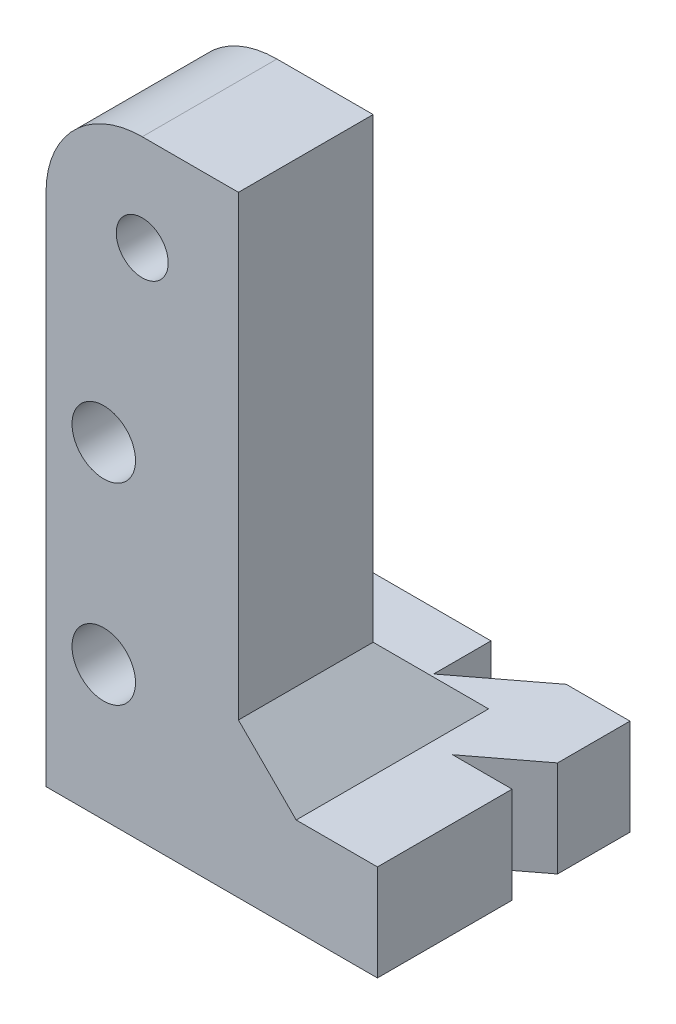
from build123d import *

# Parameters (mm, degrees)
SKETCH_1_W           = 62
SKETCH_1_H           = 46
EXTRUDE_1_DEPTH      = 5
SKETCH_2_W           = 10
SKETCH_2_H           = 17
EXTRUDE_2_DEPTH      = 7
SKETCH_3_R           = 1.65
CUT_EXTRUDE_1_DEPTH  = 12
SKETCH_7_W           = 10
SKETCH_7_H           = 7
EXTRUDE_4_DEPTH      = 9.75
CUT_EXTRUDE_4_REACH  = 65.914
SKETCH_8_R           = 1.35
CUT_EXTRUDE_2_DEPTH  = 2.7
CUT_EXTRUDE_3_REACH  = 51.981
SKETCH_5_W           = 42
SKETCH_5_H           = 32
EXTRUDE_3_DEPTH      = 5
CHAMFER_4_SIZE       = 3
FILLET_1_R           = 5
SKETCH_9_OUTSIDE_W   = 80.694
SKETCH_9_OUTSIDE_H   = 64.694
SKETCH_9_OUTSIDE_W_2 = 19.744354218
SKETCH_9_OUTSIDE_H_2 = 18.428063936
CUT_EXTRUDE_5_DEPTH  = 31.75


with BuildPart() as part:
    # 草图1 → 凸台-拉伸1 (new body)
    with BuildSketch(Plane(origin=(0, 0, 0), x_dir=(1, 0, 0), z_dir=(0, 1, 0))):
        Rectangle(SKETCH_1_W, SKETCH_1_H)
    extrude(amount=EXTRUDE_1_DEPTH)

    # 草图2 → 凸台-拉伸2 (add)
    with BuildSketch(Plane.XY.offset(23)):
        with Locations((-26, 13.5)):
            Rectangle(SKETCH_2_W, SKETCH_2_H)
        with Locations((26, 13.5)):
            Rectangle(SKETCH_2_W, SKETCH_2_H)
    extrude_2 = extrude(amount=-EXTRUDE_2_DEPTH)

    # 草图3 → 切除-拉伸1 (cut)
    with BuildSketch(Plane.XY.offset(23)):
        with Locations((-28, 17)):
            Circle(SKETCH_3_R)
        with Locations((-28, 7)):
            Circle(SKETCH_3_R)
        with Locations((28, 7)):
            Circle(SKETCH_3_R)
        with Locations((28, 17)):
            Circle(SKETCH_3_R)
    cut_extrude_1 = extrude(amount=-CUT_EXTRUDE_1_DEPTH, mode=Mode.SUBTRACT)

    # 草图7 → 凸台-拉伸4 (add)
    with BuildSketch(Plane(origin=(0, 22, 0), x_dir=(1, 0, 0), z_dir=(0, 1, 0))):
        with Locations((-26, -19.5)):
            Rectangle(SKETCH_7_W, SKETCH_7_H)
        with Locations((26, -19.5)):
            Rectangle(SKETCH_7_W, SKETCH_7_H)
    extrude_4 = extrude(amount=EXTRUDE_4_DEPTH)

    # 草图8 → 切除-拉伸4 (cut, up to next)
    with BuildSketch(Plane.XY.offset(23), mode=Mode.PRIVATE) as cut_extrude_4_sk1:
        with Locations((-26, 26.75)):
            Circle(SKETCH_8_R)
    cut_extrude_4_tool1 = extrude(cut_extrude_4_sk1.sketch, amount=-CUT_EXTRUDE_4_REACH, mode=Mode.PRIVATE) & part.part
    # 草图8 → 切除-拉伸4 (cut, up to next)
    with BuildSketch(Plane.XY.offset(23), mode=Mode.PRIVATE) as cut_extrude_4_sk2:
        with Locations((26, 26.75)):
            Circle(SKETCH_8_R)
    cut_extrude_4_tool2 = extrude(cut_extrude_4_sk2.sketch, amount=-CUT_EXTRUDE_4_REACH, mode=Mode.PRIVATE) & part.part
    cut_extrude_4_1 = cut_extrude_4_tool1.solids().sort_by_distance((-26, 26.75, 23))[0]
    add(cut_extrude_4_1, mode=Mode.SUBTRACT)
    cut_extrude_4_2 = cut_extrude_4_tool2.solids().sort_by_distance((26, 26.75, 23))[0]
    add(cut_extrude_4_2, mode=Mode.SUBTRACT)
    cut_extrude_4 = cut_extrude_4_1 + cut_extrude_4_2  # 切除-拉伸4 as one shape, for the pattern or mirror that repeats it

    # 草图4 → 切除-拉伸2 (cut)
    with BuildSketch(Plane.XY.offset(20.5)):
        Polygon((-29.616580754, 19.8), (-31.233161507, 19.8), (-31.233161507, 17), (-31.233161507, 14.2), (-29.616580754, 14.2), (-26.383419246, 14.2), (-24.766838493, 17), (-26.383419246, 19.8), align=None)
        Polygon((-24.766838493, 7), (-26.383419246, 9.8), (-29.616580754, 9.8), (-31.233161507, 9.8), (-31.233161507, 7), (-31.233161507, 4.2), (-29.616580754, 4.2), (-26.383419246, 4.2), align=None)
        Polygon((24.766838493, 17), (26.383419246, 14.2), (29.616580754, 14.2), (31.233161507, 14.2), (31.233161507, 17), (31.233161507, 19.8), (29.616580754, 19.8), (26.383419246, 19.8), align=None)
        Polygon((24.766838493, 7), (26.383419246, 4.2), (29.616580754, 4.2), (31.233161507, 4.2), (31.233161507, 7), (31.233161507, 9.8), (29.616580754, 9.8), (26.383419246, 9.8), align=None)
    cut_extrude_2 = extrude(amount=-CUT_EXTRUDE_2_DEPTH, mode=Mode.SUBTRACT)

    # 镜向1: 凸台-拉伸2, 切除-拉伸1, 凸台-拉伸4, 切除-拉伸4, 切除-拉伸2 across plane
    add(extrude_2.mirror(Plane.XY))
    add(cut_extrude_1.mirror(Plane.XY), mode=Mode.SUBTRACT)
    add(extrude_4.mirror(Plane.XY))
    add(cut_extrude_4.mirror(Plane.XY), mode=Mode.SUBTRACT)
    add(cut_extrude_2.mirror(Plane.XY), mode=Mode.SUBTRACT)

    # 草图5 → 切除-拉伸3 (cut, up to next)
    with BuildSketch(Plane(origin=(0, 31.75, 0), x_dir=(1, 0, 0), z_dir=(0, 1, 0)), mode=Mode.PRIVATE) as cut_extrude_3_sk1:
        Rectangle(SKETCH_5_W, SKETCH_5_H)
    cut_extrude_3_tool1 = extrude(cut_extrude_3_sk1.sketch, amount=-CUT_EXTRUDE_3_REACH, mode=Mode.PRIVATE) & part.part
    add(cut_extrude_3_tool1.solids().sort_by_distance((0, 31.75, 0))[0], mode=Mode.SUBTRACT)

    # 草图6 → 凸台-拉伸3 (add)
    with BuildSketch(Plane(origin=(0, 0, 0), x_dir=(1, 0, 0), z_dir=(0, 1, 0))):
        Polygon((-22.515108038, 14.0114207), (-4.12511837, 0), (0, 3.142947329), (-19.484891962, 17.9885793), align=None)
        Polygon((0, 3.142947329), (4.12511837, 0), (22.515108038, 14.0114207), (19.484891962, 17.9885793), align=None)
        Polygon((-4.12511837, 0), (0, -3.142947329), (4.12511837, 0), (0, 3.142947329), align=None)
        Polygon((-19.484891962, -17.9885793), (0, -3.142947329), (-4.12511837, 0), (-22.515108038, -14.0114207), align=None)
        Polygon((0, -3.142947329), (19.484891962, -17.9885793), (22.515108038, -14.0114207), (4.12511837, 0), align=None)
    extrude(amount=EXTRUDE_3_DEPTH)

    # 倒角4
    # the kernel refuses this chamfer: 3 mm, written as the material it adds along each edge
    with BuildSketch(Plane(origin=(-31, 5, 16), x_dir=(0, -0.027495876610586494, -0.9996219169112968), z_dir=(1, 0, 0))) as chamfer_4_piece_1_section:
        Polygon((CHAMFER_4_SIZE * 0.999621916911, CHAMFER_4_SIZE * 0.0274958766106), (-CHAMFER_4_SIZE * 0.0274958766106, CHAMFER_4_SIZE * 0.999621916911), (0, 0), align=None)
    chamfer_4_piece_1 = extrude(amount=10, mode=Mode.PRIVATE)
    chamfer_4_piece_1 = chamfer_4_piece_1 - Plane(origin=(-28, 7, 14.954388988), x_dir=(1, 0, 0), z_dir=(0, 0, 1)) * Cylinder(1.65, 32, mode=Mode.PRIVATE)
    add(chamfer_4_piece_1)
    with BuildSketch(Plane(origin=(-21, 5, 23), x_dir=(-0.02749587661058678, 0.9996219169112968, 0), z_dir=(0, 0, -1)), Plane(origin=(-21, 5, -23), x_dir=(0.9996219169112968, -0.02749587661058648, 0), z_dir=(0, 0, 1)), Plane(origin=(21, 5, 23), x_dir=(-0.9996219169112968, -0.02749587661058619, 0), z_dir=(0, 0, -1))) as chamfer_4_piece_2:
        Polygon((CHAMFER_4_SIZE * 0.999621916911, CHAMFER_4_SIZE * 0.0274958766106), (-CHAMFER_4_SIZE * 0.0274958766106, CHAMFER_4_SIZE * 0.999621916911), (0, 0), align=None)
    extrude(amount=7)
    with BuildSketch(Plane(origin=(-31, 5, -16), x_dir=(0, -0.027495876610586494, 0.9996219169112968), z_dir=(1, 0, 0))) as chamfer_4_piece_3_section:
        Polygon((CHAMFER_4_SIZE * 0.999621916911, -CHAMFER_4_SIZE * 0.0274958766106), (-CHAMFER_4_SIZE * 0.0274958766106, -CHAMFER_4_SIZE * 0.999621916911), (0, 0), align=None)
    chamfer_4_piece_3 = extrude(amount=10, mode=Mode.PRIVATE)
    chamfer_4_piece_3 = chamfer_4_piece_3 - Plane(origin=(-28, 7, -14.954388988), x_dir=(1, 0, 0), z_dir=(0, 0, -1)) * Cylinder(1.65, 32, mode=Mode.PRIVATE)
    add(chamfer_4_piece_3)
    with BuildSketch(Plane(origin=(21, 5, -23), x_dir=(-0.9996219169112968, -0.02749587661058619, 0), z_dir=(0, 0, 1))) as chamfer_4_piece_4:
        Polygon((CHAMFER_4_SIZE * 0.999621916911, -CHAMFER_4_SIZE * 0.0274958766106), (-CHAMFER_4_SIZE * 0.0274958766106, -CHAMFER_4_SIZE * 0.999621916911), (0, 0), align=None)
    extrude(amount=7)
    with BuildSketch(Plane(origin=(31, 5, -16), x_dir=(0, -0.027495876610586494, 0.9996219169112968), z_dir=(-1, 0, 0))) as chamfer_4_piece_5_section:
        Polygon((CHAMFER_4_SIZE * 0.999621916911, CHAMFER_4_SIZE * 0.0274958766106), (-CHAMFER_4_SIZE * 0.0274958766106, CHAMFER_4_SIZE * 0.999621916911), (0, 0), align=None)
    chamfer_4_piece_5 = extrude(amount=10, mode=Mode.PRIVATE)
    chamfer_4_piece_5 = chamfer_4_piece_5 - Plane(origin=(28, 7, -14.954389008), x_dir=(1, 0, 0), z_dir=(0, 0, -1)) * Cylinder(1.65, 32, mode=Mode.PRIVATE)
    add(chamfer_4_piece_5)
    with BuildSketch(Plane(origin=(31, 5, 16), x_dir=(0, -0.027495876610586494, -0.9996219169112968), z_dir=(-1, 0, 0))) as chamfer_4_piece_6_section:
        Polygon((CHAMFER_4_SIZE * 0.999621916911, -CHAMFER_4_SIZE * 0.0274958766106), (-CHAMFER_4_SIZE * 0.0274958766106, -CHAMFER_4_SIZE * 0.999621916911), (0, 0), align=None)
    chamfer_4_piece_6 = extrude(amount=10, mode=Mode.PRIVATE)
    chamfer_4_piece_6 = chamfer_4_piece_6 - Plane(origin=(28, 7, 14.954389008), x_dir=(1, 0, 0), z_dir=(0, 0, 1)) * Cylinder(1.65, 32, mode=Mode.PRIVATE)
    add(chamfer_4_piece_6)
    with BuildSketch(Plane(origin=(-21, 5, 23), x_dir=(-0.02749587661058678, 0.9996219169112968, 0), z_dir=(0, 0, -1))) as chamfer_4_piece_7a_section:
        Polygon((CHAMFER_4_SIZE * 0.999621916911, CHAMFER_4_SIZE * 0.0274958766106), (-CHAMFER_4_SIZE * 0.0274958766106, CHAMFER_4_SIZE * 0.999621916911), (0, 0), align=None)
    chamfer_4_piece_7a = extrude(amount=14.715048964, mode=Mode.PRIVATE)
    chamfer_4_piece_7a = split(chamfer_4_piece_7a, bisect_by=Plane(origin=(-19.8988735, 5.929641192, 16), z_dir=(0, 0, -1)), keep=Keep.TOP, mode=Mode.PRIVATE)
    chamfer_4_piece_7a = split(chamfer_4_piece_7a, bisect_by=Plane(origin=(-20.858643002, 5.929641192, 12.749352101), z_dir=(0.6060432152628566, 0, 0.7954317200324984)), keep=Keep.TOP, mode=Mode.PRIVATE)
    with BuildSketch(Plane(origin=(-31, 5, 16), x_dir=(0, -0.027495876610586494, -0.9996219169112968), z_dir=(1, 0, 0))) as chamfer_4_piece_7b_section:
        Polygon((CHAMFER_4_SIZE * 0.999621916911, CHAMFER_4_SIZE * 0.0274958766106), (-CHAMFER_4_SIZE * 0.0274958766106, CHAMFER_4_SIZE * 0.999621916911), (0, 0), align=None)
    chamfer_4_piece_7b = extrude(amount=17.715048964, mode=Mode.PRIVATE)
    chamfer_4_piece_7b = split(chamfer_4_piece_7b, bisect_by=Plane(origin=(-21, 5.915915897, 14.873215442), z_dir=(1, 0, 0)), keep=Keep.TOP, mode=Mode.PRIVATE)
    chamfer_4_piece_7b = split(chamfer_4_piece_7b, bisect_by=Plane(origin=(-17.170062576, 5.915915897, 16.224899768), z_dir=(-0.6060432152628568, 0, -0.7954317200324983)), keep=Keep.TOP, mode=Mode.PRIVATE)
    chamfer_4_piece_7 = chamfer_4_piece_7a & chamfer_4_piece_7b
    add(chamfer_4_piece_7)
    with BuildSketch(Plane(origin=(-21, 5, -23), x_dir=(0.9996219169112968, -0.02749587661058648, 0), z_dir=(0, 0, 1))) as chamfer_4_piece_8a_section:
        Polygon((CHAMFER_4_SIZE * 0.999621916911, CHAMFER_4_SIZE * 0.0274958766106), (-CHAMFER_4_SIZE * 0.0274958766106, CHAMFER_4_SIZE * 0.999621916911), (0, 0), align=None)
    chamfer_4_piece_8a = extrude(amount=14.715048964, mode=Mode.PRIVATE)
    chamfer_4_piece_8a = split(chamfer_4_piece_8a, bisect_by=Plane(origin=(-20.858643002, 5.929641192, -12.749352101), z_dir=(0.6060432152628563, 0, -0.7954317200324986)), keep=Keep.TOP, mode=Mode.PRIVATE)
    chamfer_4_piece_8a = split(chamfer_4_piece_8a, bisect_by=Plane(origin=(-19.8988735, 5.929641192, -16), z_dir=(0, 0, 1)), keep=Keep.TOP, mode=Mode.PRIVATE)
    with BuildSketch(Plane(origin=(-31, 5, -16), x_dir=(0, -0.027495876610586494, 0.9996219169112968), z_dir=(1, 0, 0))) as chamfer_4_piece_8b_section:
        Polygon((CHAMFER_4_SIZE * 0.999621916911, -CHAMFER_4_SIZE * 0.0274958766106), (-CHAMFER_4_SIZE * 0.0274958766106, -CHAMFER_4_SIZE * 0.999621916911), (0, 0), align=None)
    chamfer_4_piece_8b = extrude(amount=17.715048964, mode=Mode.PRIVATE)
    chamfer_4_piece_8b = split(chamfer_4_piece_8b, bisect_by=Plane(origin=(-17.170062576, 5.915915897, -16.224899768), z_dir=(-0.6060432152628565, 0, 0.7954317200324984)), keep=Keep.TOP, mode=Mode.PRIVATE)
    chamfer_4_piece_8b = split(chamfer_4_piece_8b, bisect_by=Plane(origin=(-21, 5.915915897, -14.873215442), z_dir=(1, 0, 0)), keep=Keep.TOP, mode=Mode.PRIVATE)
    chamfer_4_piece_8 = chamfer_4_piece_8a & chamfer_4_piece_8b
    add(chamfer_4_piece_8)
    with BuildSketch(Plane(origin=(31, 5, -16), x_dir=(0, -0.027495876610586494, 0.9996219169112968), z_dir=(-1, 0, 0))) as chamfer_4_piece_9a_section:
        Polygon((CHAMFER_4_SIZE * 0.999621916911, CHAMFER_4_SIZE * 0.0274958766106), (-CHAMFER_4_SIZE * 0.0274958766106, CHAMFER_4_SIZE * 0.999621916911), (0, 0), align=None)
    chamfer_4_piece_9a = extrude(amount=17.715048964, mode=Mode.PRIVATE)
    chamfer_4_piece_9a = split(chamfer_4_piece_9a, bisect_by=Plane(origin=(17.170062576, 5.915915897, -16.224899768), z_dir=(0.6060432152628568, 0, 0.7954317200324984)), keep=Keep.TOP, mode=Mode.PRIVATE)
    chamfer_4_piece_9a = split(chamfer_4_piece_9a, bisect_by=Plane(origin=(21, 5.915915897, -14.873215442), z_dir=(-1, 0, 0)), keep=Keep.TOP, mode=Mode.PRIVATE)
    with BuildSketch(Plane(origin=(21, 5, -23), x_dir=(-0.9996219169112968, -0.02749587661058619, 0), z_dir=(0, 0, 1))) as chamfer_4_piece_9b_section:
        Polygon((CHAMFER_4_SIZE * 0.999621916911, -CHAMFER_4_SIZE * 0.0274958766106), (-CHAMFER_4_SIZE * 0.0274958766106, -CHAMFER_4_SIZE * 0.999621916911), (0, 0), align=None)
    chamfer_4_piece_9b = extrude(amount=14.715048964, mode=Mode.PRIVATE)
    chamfer_4_piece_9b = split(chamfer_4_piece_9b, bisect_by=Plane(origin=(20.858643002, 5.929641192, -12.749352101), z_dir=(-0.6060432152628568, 0, -0.7954317200324983)), keep=Keep.TOP, mode=Mode.PRIVATE)
    chamfer_4_piece_9b = split(chamfer_4_piece_9b, bisect_by=Plane(origin=(19.8988735, 5.929641192, -16), z_dir=(0, 0, 1)), keep=Keep.TOP, mode=Mode.PRIVATE)
    chamfer_4_piece_9 = chamfer_4_piece_9a & chamfer_4_piece_9b
    add(chamfer_4_piece_9)
    with BuildSketch(Plane(origin=(21, 5, 23), x_dir=(-0.9996219169112968, -0.02749587661058619, 0), z_dir=(0, 0, -1))) as chamfer_4_piece_10a_section:
        Polygon((CHAMFER_4_SIZE * 0.999621916911, CHAMFER_4_SIZE * 0.0274958766106), (-CHAMFER_4_SIZE * 0.0274958766106, CHAMFER_4_SIZE * 0.999621916911), (0, 0), align=None)
    chamfer_4_piece_10a = extrude(amount=14.715048964, mode=Mode.PRIVATE)
    chamfer_4_piece_10a = split(chamfer_4_piece_10a, bisect_by=Plane(origin=(20.858643002, 5.929641192, 12.749352101), z_dir=(-0.6060432152628565, 0, 0.7954317200324984)), keep=Keep.TOP, mode=Mode.PRIVATE)
    chamfer_4_piece_10a = split(chamfer_4_piece_10a, bisect_by=Plane(origin=(19.8988735, 5.929641192, 16), z_dir=(0, 0, -1)), keep=Keep.TOP, mode=Mode.PRIVATE)
    with BuildSketch(Plane(origin=(31, 5, 16), x_dir=(0, -0.027495876610586494, -0.9996219169112968), z_dir=(-1, 0, 0))) as chamfer_4_piece_10b_section:
        Polygon((CHAMFER_4_SIZE * 0.999621916911, -CHAMFER_4_SIZE * 0.0274958766106), (-CHAMFER_4_SIZE * 0.0274958766106, -CHAMFER_4_SIZE * 0.999621916911), (0, 0), align=None)
    chamfer_4_piece_10b = extrude(amount=17.715048964, mode=Mode.PRIVATE)
    chamfer_4_piece_10b = split(chamfer_4_piece_10b, bisect_by=Plane(origin=(17.170062576, 5.915915897, 16.224899768), z_dir=(0.6060432152628563, 0, -0.7954317200324986)), keep=Keep.TOP, mode=Mode.PRIVATE)
    chamfer_4_piece_10b = split(chamfer_4_piece_10b, bisect_by=Plane(origin=(21, 5.915915897, 14.873215442), z_dir=(-1, 0, 0)), keep=Keep.TOP, mode=Mode.PRIVATE)
    chamfer_4_piece_10 = chamfer_4_piece_10a & chamfer_4_piece_10b
    add(chamfer_4_piece_10)

    # 圆角1
    fillet_1_edges = [part.edges().sort_by_distance(p)[0] for p in [
        (-31, 31.75, -19.5),
        (31, 31.75, -19.5),
        (-31, 31.75, 19.5),
        (31, 31.75, 19.5),
    ]]
    fillet(fillet_1_edges, radius=FILLET_1_R)

    # 草图9 outside → 切除-拉伸5 (cut)
    with BuildSketch(Plane(origin=(0, 0, 0), x_dir=(1, 0, 0), z_dir=(0, 1, 0))):
        Rectangle(SKETCH_9_OUTSIDE_W, SKETCH_9_OUTSIDE_H)
        with Locations((-23.649265304, -19.089518312)):
            Rectangle(SKETCH_9_OUTSIDE_W_2, SKETCH_9_OUTSIDE_H_2, mode=Mode.SUBTRACT)
    extrude(amount=CUT_EXTRUDE_5_DEPTH, mode=Mode.SUBTRACT)


solid = part.part
